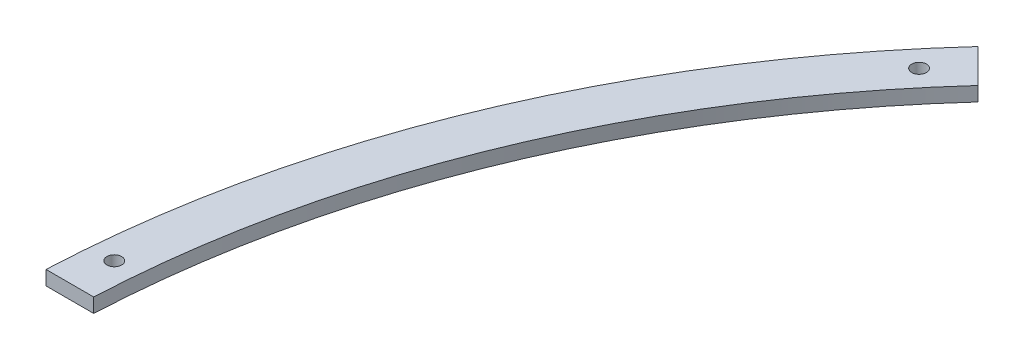
from build123d import *

# Parameters (mm, degrees)
BASE_DEPTH                 = 1.5
F_3_1_3_1_DIAMETER_HOLE1_D = 3.1


with BuildPart() as part:
    # Sketch1 → base (new, symmetric)
    with BuildSketch(Plane(origin=(0, 0, 0), x_dir=(1, 0, 0), z_dir=(0, 1, 0))):
        with BuildLine():
            Line((-155.395037554, 141.25290193), (-162.473770491, 148.331634867))
            ThreePointArc((-162.473770491, 148.331634867), (-203.253497152, 84.19035512), (-219.772609758, 10))
            Line((-219.772609758, 10), (-209.761769634, 10))
            ThreePointArc((-209.761769634, 10), (-194.014701827, 80.363520797), (-155.395037554, 141.25290193))
        make_face()
    extrude(amount=BASE_DEPTH, both=True)

    # Ø3.1 (3.1) Diameter Hole1 (through all)
    with Locations(Plane(origin=(0, 1.5, 0), x_dir=(1, 0, 0), z_dir=(0, 1, 0))):
        with Locations((-214.18186009, 18.738484691), (-164.699555271, 138.199336083)):
            Hole(F_3_1_3_1_DIAMETER_HOLE1_D / 2)


solid = part.part
